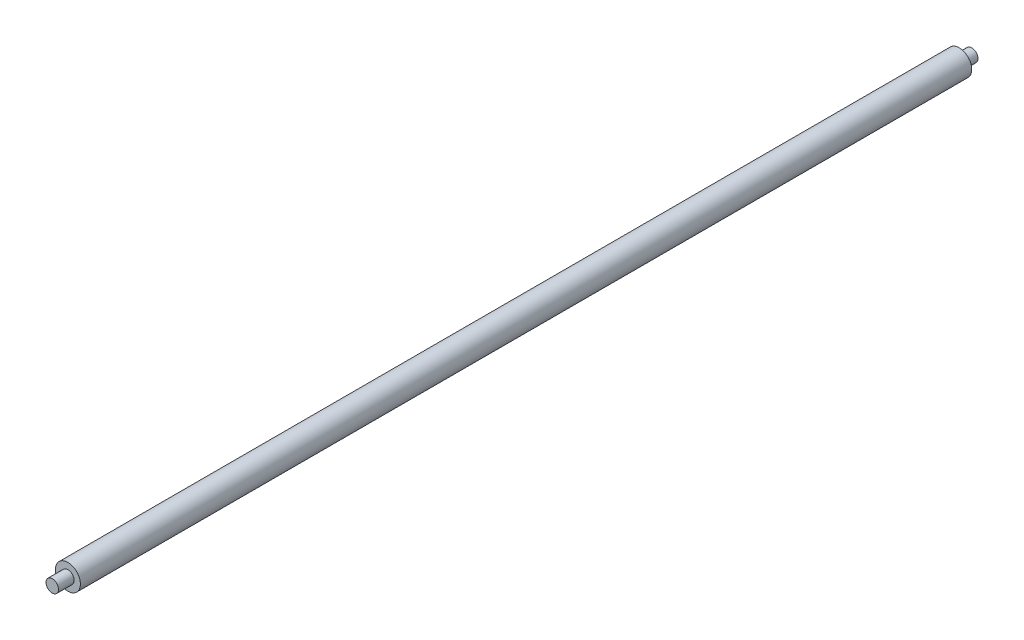
from build123d import *

# Parameters (mm, degrees)
SKETCH1_R           = 6
BOSS_EXTRUDE1_DEPTH = 220.5
SKETCH2_R           = 6
SKETCH2_R_2         = 3
CUT_EXTRUDE1_DEPTH  = 7.5
CUT_EXTRUDE2_START  = -6
SKETCH3_R           = 6
SKETCH3_R_2         = 3
CUT_EXTRUDE2_DEPTH  = 6


with BuildPart() as part:
    # Sketch1 → Boss-Extrude1 (new, symmetric)
    with BuildSketch(Plane.XY):
        Circle(SKETCH1_R)
    extrude(amount=BOSS_EXTRUDE1_DEPTH, both=True)

    # Sketch2 → Cut-Extrude1 (cut)
    with BuildSketch(Plane.XY.offset(220.5)):
        Circle(SKETCH2_R)
        Circle(SKETCH2_R_2, mode=Mode.SUBTRACT)
    extrude(amount=-CUT_EXTRUDE1_DEPTH, mode=Mode.SUBTRACT)

    # Sketch3 → Cut-Extrude2 (cut)
    with BuildSketch(Plane(origin=(0, 0, -220.5), x_dir=(-1, 0, 0), z_dir=(0, 0, -1)).offset(CUT_EXTRUDE2_START)):
        Circle(SKETCH3_R)
        Circle(SKETCH3_R_2, mode=Mode.SUBTRACT)
    extrude(amount=CUT_EXTRUDE2_DEPTH, mode=Mode.SUBTRACT)


solid = part.part
